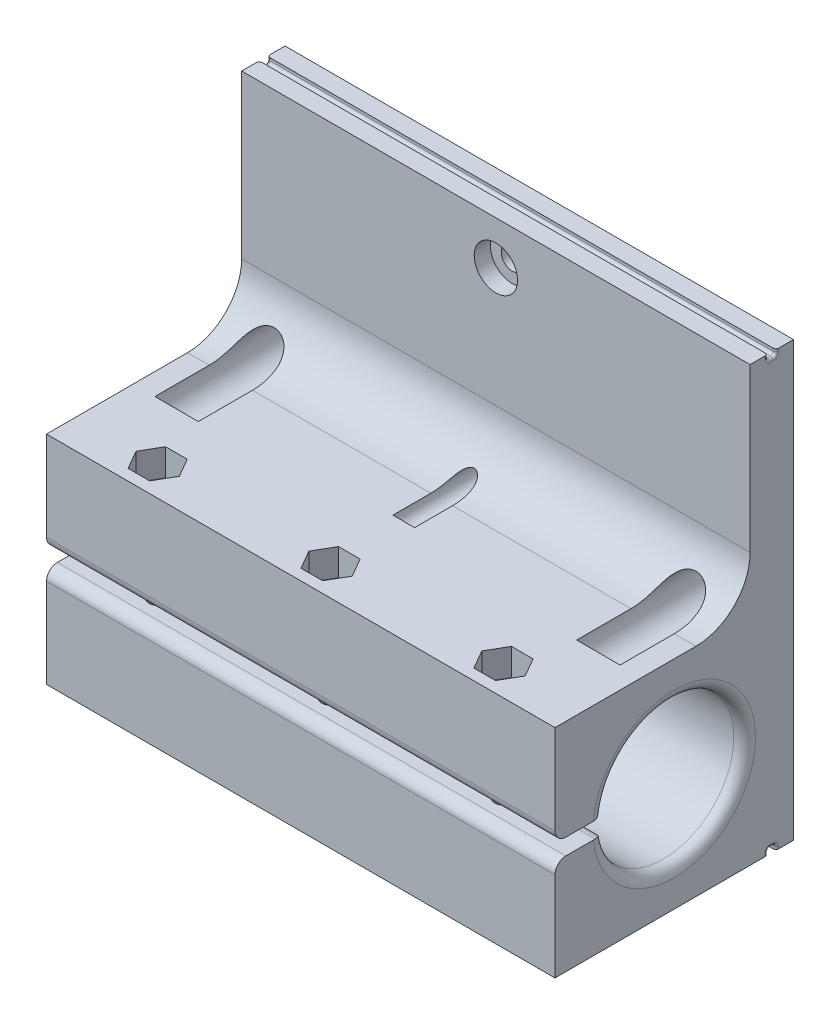
from build123d import *

# Parameters (mm, degrees)
SKETCH1_W               = 93.8
SKETCH1_H               = 80
BOSS_EXTRUDE1_DEPTH     = 8
SKETCH4_R               = 2
CUT_EXTRUDE2_DEPTH      = 63.157943981
CUT_EXTRUDE3_DEPTH      = 5
SKETCH9_W               = 93.8
SKETCH9_H               = 40
BOSS_EXTRUDE2_DEPTH     = 36
CUT_EXTRUDE5_DEPTH      = 20
CUT_EXTRUDE5_DEPTH_BACK = 3
SKETCH8_R               = 4
SKETCH7_R               = 2
CUT_EXTRUDE4_DEPTH      = 20
FILLET1_R               = 10
CUT_EXTRUDE6_DEPTH      = 112.060524124
FILLET2_R               = 2
SKETCH11_R              = 1.6
CUT_EXTRUDE7_DEPTH      = 103.64311964
CUT_EXTRUDE8_DEPTH      = 5
SKETCH13_R              = 4.5
CUT_EXTRUDE9_DEPTH      = 3
SKETCH14_W              = 8
SKETCH14_H              = 5
CUT_EXTRUDE10_DEPTH     = 15
SKETCH15_R              = 2
CUT_EXTRUDE11_DEPTH     = 5
SKETCH16_W              = 1.5
SKETCH16_H              = 1
CUT_EXTRUDE12_DEPTH     = 112.060524124
FILLET3_R               = 0.5


with BuildPart() as part:
    # Sketch1 → Boss-Extrude1 (new body)
    with BuildSketch(Plane.XY):
        Rectangle(SKETCH1_W, SKETCH1_H)
    extrude(amount=BOSS_EXTRUDE1_DEPTH)

    # Sketch4 → Cut-Extrude2 (cut, through all)
    with BuildSketch(Plane(origin=(0, 0, 0), x_dir=(-1, 0, 0), z_dir=(0, 0, -1))):
        with Locations((0, -32)):
            Circle(SKETCH4_R)
        with Locations((0, 32)):
            Circle(SKETCH4_R)
        with Locations((38.9, 0)):
            Circle(SKETCH4_R)
        with Locations((-38.9, 0)):
            Circle(SKETCH4_R)
    extrude(amount=-CUT_EXTRUDE2_DEPTH, mode=Mode.SUBTRACT)

    # Sketch5 → Cut-Extrude3 (cut)
    with BuildSketch(Plane(origin=(0, 0, 0), x_dir=(-1, 0, 0), z_dir=(0, 0, -1))):
        Polygon((0, 4.001037365), (-3.465, 2.000518683), (-3.465, -2.000518683), (0, -4.001037365), (3.465, -2.000518683), (3.465, 2.000518683), align=None)
    extrude(amount=-CUT_EXTRUDE3_DEPTH, mode=Mode.SUBTRACT)

    # Sketch9 → Boss-Extrude2 (add)
    with BuildSketch(Plane.XY.offset(8)):
        with Locations((0, -20)):
            Rectangle(SKETCH9_W, SKETCH9_H)
    extrude(amount=BOSS_EXTRUDE2_DEPTH)

    # Sketch8 → Cut-Extrude5 (cut, two sides: drawn at the far end of the back side and taken through both)
    with BuildSketch(Plane.XY.offset(8).offset(-CUT_EXTRUDE5_DEPTH_BACK)):
        with Locations(Location((0, 32, 0), (0, 0, 180))):
            Circle(SKETCH8_R)
        with Locations((-38.9, 0)):
            Circle(SKETCH8_R)
        with Locations((38.9, 0)):
            Circle(SKETCH8_R)
    extrude(amount=CUT_EXTRUDE5_DEPTH + CUT_EXTRUDE5_DEPTH_BACK, mode=Mode.SUBTRACT)

    # Sketch7 → Cut-Extrude4 (cut)
    with BuildSketch(Plane(origin=(0, 0, 5), x_dir=(-1, 0, 0), z_dir=(0, 0, -1))):
        Circle(SKETCH7_R)
    extrude(amount=-CUT_EXTRUDE4_DEPTH, mode=Mode.SUBTRACT)

    # Fillet1
    # the kernel refuses this fillet: 10 mm, written as the material it adds along each edge
    with BuildSketch(Plane(origin=(46.9, 0, 8), x_dir=(0, 1, 0), z_dir=(-1, 0, 0))) as fillet1_piece_1_section:
        with BuildLine():
            CenterArc((FILLET1_R, -FILLET1_R), FILLET1_R, 90, 90)
            Line((0, -FILLET1_R), (0, 0))
            Line((0, 0), (FILLET1_R, 0))
        make_face()
    fillet1_piece_1 = extrude(amount=29, mode=Mode.PRIVATE)
    fillet1_piece_1 = fillet1_piece_1 - Plane(origin=(38.9, 0, 10.111081098), x_dir=(1, 0, 0), z_dir=(0, 0, 1)) * Cylinder(4, 99, mode=Mode.PRIVATE)
    add(fillet1_piece_1)
    with BuildSketch(Plane(origin=(59.9, 0, 8), x_dir=(0, 1, 0), z_dir=(-1, 0, 0))) as fillet1_piece_2_section:
        with BuildLine():
            CenterArc((FILLET1_R, -FILLET1_R), FILLET1_R, 90, 90)
            Line((0, -FILLET1_R), (0, 0))
            Line((0, 0), (FILLET1_R, 0))
        make_face()
    fillet1_piece_2 = extrude(amount=82.9, mode=Mode.PRIVATE)
    fillet1_piece_2 = split(fillet1_piece_2, bisect_by=Plane(origin=(46.9, 2.413411128, 10.17017777), z_dir=(-1, 0, 0)), keep=Keep.TOP, mode=Mode.PRIVATE)
    fillet1_piece_2 = fillet1_piece_2 - Plane(origin=(38.9, 0, 10.17017777), x_dir=(1, 0, 0), z_dir=(0, 0, 1)) * Cylinder(4, 206, mode=Mode.PRIVATE)
    fillet1_piece_2 = fillet1_piece_2 - Plane(origin=(0, 0, 10.17017777), x_dir=(-1, 0, 0), z_dir=(0, 0, -1)) * Cylinder(2, 206, mode=Mode.PRIVATE)
    add(fillet1_piece_2)
    with BuildSketch(Plane(origin=(-17.9, 0, 8), x_dir=(0, 1, 0), z_dir=(-1, 0, 0))) as fillet1_piece_3_section:
        with BuildLine():
            CenterArc((FILLET1_R, -FILLET1_R), FILLET1_R, 90, 90)
            Line((0, -FILLET1_R), (0, 0))
            Line((0, 0), (FILLET1_R, 0))
        make_face()
    fillet1_piece_3 = extrude(amount=29, mode=Mode.PRIVATE)
    fillet1_piece_3 = fillet1_piece_3 - Plane(origin=(-38.9, 0, 10.111081535), x_dir=(1, 0, 0), z_dir=(0, 0, 1)) * Cylinder(4, 98, mode=Mode.PRIVATE)
    add(fillet1_piece_3)
    with BuildSketch(Plane(origin=(23, 0, 8), x_dir=(0, 1, 0), z_dir=(-1, 0, 0))) as fillet1_piece_4_section:
        with BuildLine():
            CenterArc((FILLET1_R, -FILLET1_R), FILLET1_R, 90, 90)
            Line((0, -FILLET1_R), (0, 0))
            Line((0, 0), (FILLET1_R, 0))
        make_face()
    fillet1_piece_4 = extrude(amount=82.9, mode=Mode.PRIVATE)
    fillet1_piece_4 = split(fillet1_piece_4, bisect_by=Plane(origin=(-46.9, 2.413413165, 10.170175077), z_dir=(1, 0, 0)), keep=Keep.TOP, mode=Mode.PRIVATE)
    fillet1_piece_4 = fillet1_piece_4 - Plane(origin=(0, 0, 10.170175077), x_dir=(-1, 0, 0), z_dir=(0, 0, -1)) * Cylinder(2, 206, mode=Mode.PRIVATE)
    fillet1_piece_4 = fillet1_piece_4 - Plane(origin=(-38.9, 0, 10.170175077), x_dir=(1, 0, 0), z_dir=(0, 0, 1)) * Cylinder(4, 206, mode=Mode.PRIVATE)
    add(fillet1_piece_4)

    # Sketch10 → Cut-Extrude6 (cut, through all)
    with BuildSketch(Plane.ZY.offset(46.9)):
        with BuildLine():
            Line((34.91317157, -18.5), (44, -18.5))
            Line((44, -18.5), (44, -21.5))
            Line((44, -21.5), (34.91317157, -21.5))
            ThreePointArc((34.91317157, -21.5), (9, -20), (34.91317157, -18.5))
        make_face()
    extrude(amount=-CUT_EXTRUDE6_DEPTH, mode=Mode.SUBTRACT)

    # Fillet2
    fillet2_edges = [part.edges().sort_by_distance(p)[0] for p in [
        (46.9, -20, 9),
        (0, -21.5, 34.91317157),
        (0, -18.5, 34.91317157),
        (0, -18.5, 44),
        (0, -21.5, 44),
        (-46.9, -20, 9),
    ]]
    fillet(fillet2_edges, radius=FILLET2_R)

    # Sketch11 → Cut-Extrude7 (cut, through all)
    with BuildSketch(Plane.XZ.offset(40)):
        with Locations(Location((-31.9, 38.5, 0), (0, 0, 270))):
            Circle(SKETCH11_R)
        with Locations(Location((0, 38.5, 0), (0, 0, 270))):
            Circle(SKETCH11_R)
        with Locations(Location((31.9, 38.5, 0), (0, 0, 270))):
            Circle(SKETCH11_R)
    extrude(amount=-CUT_EXTRUDE7_DEPTH, mode=Mode.SUBTRACT)

    # Sketch12 → Cut-Extrude8 (cut)
    with BuildSketch(Plane(origin=(0, 0, 0), x_dir=(1, 0, 0), z_dir=(0, 1, 0))):
        Polygon((-27.904736137, -38.5), (-29.902368069, -35.04), (-33.897631931, -35.04), (-35.895263863, -38.5), (-33.897631931, -41.96), (-29.902368069, -41.96), align=None)
        Polygon((3.995263863, -38.5), (1.997631931, -35.04), (-1.997631931, -35.04), (-3.995263863, -38.5), (-1.997631931, -41.96), (1.997631931, -41.96), align=None)
        Polygon((35.895263863, -38.5), (33.897631931, -35.04), (29.902368069, -35.04), (27.904736137, -38.5), (29.902368069, -41.96), (33.897631931, -41.96), align=None)
    extrude(amount=-CUT_EXTRUDE8_DEPTH, mode=Mode.SUBTRACT)

    # Sketch13 → Cut-Extrude9 (cut)
    with BuildSketch(Plane.XZ.offset(40)):
        with Locations(Location((-31.9, 38.5, 0), (0, 0, 270))):
            Circle(SKETCH13_R)
        with Locations(Location((0, 38.5, 0), (0, 0, 270))):
            Circle(SKETCH13_R)
        with Locations(Location((31.9, 38.5, 0), (0, 0, 270))):
            Circle(SKETCH13_R)
    extrude(amount=-CUT_EXTRUDE9_DEPTH, mode=Mode.SUBTRACT)

    # Sketch14 → Cut-Extrude10 (cut)
    with BuildSketch(Plane.XZ.offset(40)):
        with Locations((0, 10.5)):
            Rectangle(SKETCH14_W, SKETCH14_H)
    extrude(amount=-CUT_EXTRUDE10_DEPTH, mode=Mode.SUBTRACT)

    # Sketch15 → Cut-Extrude11 (cut)
    with BuildSketch(Plane(origin=(0, 0, 13), x_dir=(-1, 0, 0), z_dir=(0, 0, -1))):
        with Locations((0, -32)):
            Circle(SKETCH15_R)
    extrude(amount=-CUT_EXTRUDE11_DEPTH, mode=Mode.SUBTRACT)

    # Sketch16 → Cut-Extrude12 (cut, through all)
    with BuildSketch(Plane.ZY.offset(46.9)):
        with Locations((4, -39.5)):
            Rectangle(SKETCH16_W, SKETCH16_H)
        with Locations((4, 39.5)):
            Rectangle(SKETCH16_W, SKETCH16_H)
    extrude(amount=-CUT_EXTRUDE12_DEPTH, mode=Mode.SUBTRACT)

    # Fillet3
    fillet3_edges = [part.edges().sort_by_distance(p)[0] for p in [
        (46.9, 39.5, 3.25),
        (0, 39, 3.25),
        (46.9, 39.5, 4.75),
        (46.9, 39, 4),
        (0, 39, 4.75),
        (-46.9, 39.5, 3.25),
        (-46.9, 39, 4),
        (-46.9, 39.5, 4.75),
        (46.9, -39, 4),
        (0, -39, 3.25),
        (46.9, -39.5, 3.25),
        (46.9, -39.5, 4.75),
        (0, -39, 4.75),
        (-46.9, -39.5, 4.75),
        (-46.9, -39, 4),
        (-46.9, -39.5, 3.25),
    ]]
    fillet(fillet3_edges, radius=FILLET3_R)


solid = part.part
